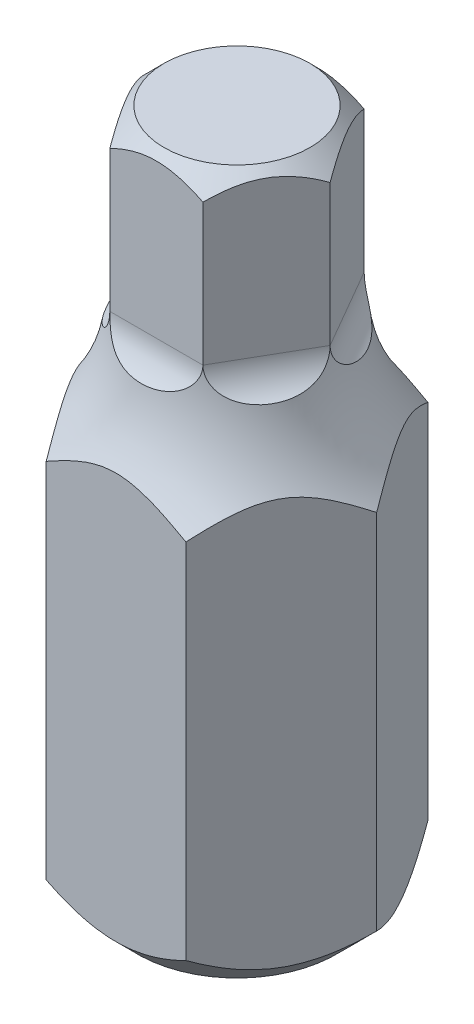
from build123d import *

# Parameters (mm, degrees)
BOSS_EXTRUDE1_DEPTH = 12
BOSS_EXTRUDE2_DEPTH = 5
FILLET1_R           = 1


with BuildPart() as part:
    # Sketch1 → Boss-Extrude1 (new body)
    with BuildSketch(Plane(origin=(0, 0, 0), x_dir=(1, 0, 0), z_dir=(0, 1, 0))):
        Polygon((3.464101615, 0), (1.732050808, 3), (-1.732050808, 3), (-3.464101615, 0), (-1.732050808, -3), (1.732050808, -3), align=None)
    extrude(amount=-BOSS_EXTRUDE1_DEPTH)

    # Sketch1<3> → Boss-Extrude2 (add)
    with BuildSketch(Plane(origin=(0, 0, 0), x_dir=(1, 0, 0), z_dir=(0, 1, 0))):
        Polygon((2.309401077, 0), (1.154700538, 2), (-1.154700538, 2), (-2.309401077, 0), (-1.154700538, -2), (1.154700538, -2), align=None)
    extrude(amount=BOSS_EXTRUDE2_DEPTH)

    # Fillet1
    fillet1_edges = [part.edges().sort_by_distance(p)[0] for p in [
        (-1.732050808, 0, 1),
        (0, 0, 2),
        (1.732050808, 0, 1),
        (1.732050808, 0, -1),
        (0, 0, -2),
        (-1.732050808, 0, -1),
    ]]
    fillet(fillet1_edges, radius=FILLET1_R - 0.0001)  # a hair under: the kernel refuses the full size

    # Sketch2 → Cut-Revolve1 (revolve, cut)
    with BuildSketch(Plane.XY):
        Polygon((-3.464101615, -12), (-3.464101615, -11), (-2.464101615, -12), align=None)
        Polygon((-1.809401077, 5), (-2.309401077, 5), (-2.309401077, 4.5), align=None)
        with BuildLine():
            Line((2.309401077, 1), (6.809401077, 1))
            Line((6.809401077, 1), (6.809401077, -3.5))
            ThreePointArc((6.809401077, -3.5), (3.627420561, -2.181980515), (2.309401077, 1))
        make_face()
    revolve(axis=Axis((0, 5, 0), (0, -1, 0)), mode=Mode.SUBTRACT)


solid = part.part
